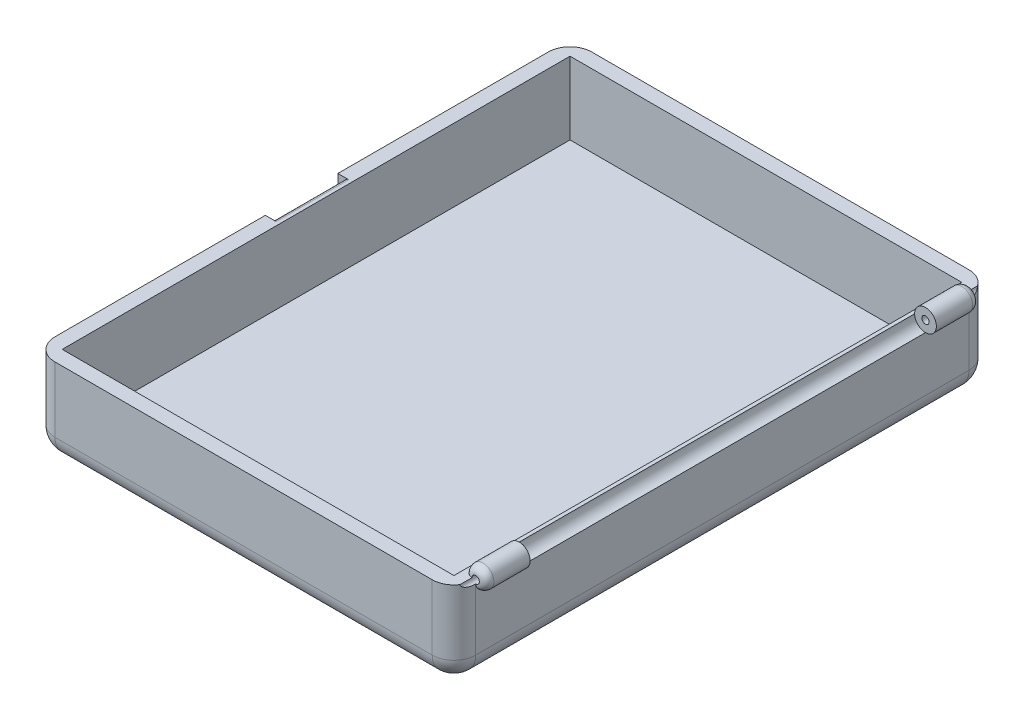
from build123d import *

# Parameters (mm, degrees)
BOTTOM_W                 = 58
BOTTOM_H                 = 74
BOTTOM_W_2               = 54
BOTTOM_H_2               = 70
DUVAR_DEPTH              = 12
BOTTOM_2_W               = 54
BOTTOM_2_H               = 70
TABAN_DEPTH              = 2
FILLET2_R                = 3
MENTESE_OUT_R            = 1.5
MENTESE_DEPTH            = 68
MENTESE_DELIK_DEPTH      = 93.355292214
MENTESE_DELIK_DEPTH_BACK = 93.355292214
MENTESE_IN_R             = 0.5
MENTESE_FILLET_R         = 1
MENTESE_OUT_CUT_R        = 1.5
MENTESE_BOSLUK_DEPTH     = 56
CENTIK_W                 = 1.5
CENTIK_H                 = 10
CENTIK_BOSLUK_DEPTH      = 7
DIL_R                    = 0.5
BOSS_EXTRUDE5_DEPTH      = 10


with BuildPart() as part:
    # bottom → duvar (new body)
    with BuildSketch(Plane(origin=(0, 0, 0), x_dir=(1, 0, 0), z_dir=(0, 1, 0))):
        with Locations((27, 35)):
            Rectangle(BOTTOM_W, BOTTOM_H)
        with Locations((27, 35)):
            Rectangle(BOTTOM_W_2, BOTTOM_H_2, mode=Mode.SUBTRACT)
    extrude(amount=DUVAR_DEPTH)

    # bottom<2> → taban (add)
    with BuildSketch(Plane(origin=(0, 0, 0), x_dir=(1, 0, 0), z_dir=(0, 1, 0))):
        with Locations((27, 35)):
            Rectangle(BOTTOM_2_W, BOTTOM_2_H)
    extrude(amount=TABAN_DEPTH)

    # Fillet2
    fillet2_edges = [part.edges().sort_by_distance(p)[0] for p in [
        (27, 0, -72),
        (56, 0, -35),
        (27, 0, 2),
        (-2, 0, -35),
        (-2, 6, -72),
        (56, 6, -72),
        (56, 6, 2),
        (-2, 6, 2),
    ]]
    fillet(fillet2_edges, radius=FILLET2_R)

    # mentese out → mentese (add)
    with BuildSketch(Plane(origin=(0, 0, -69), x_dir=(-1, 0, 0), z_dir=(0, 0, -1))):
        with Locations((-56, 12)):
            Circle(MENTESE_OUT_R)
    extrude(amount=-MENTESE_DEPTH)

    # mentese in → mentese delik (cut, two sides: drawn at the far end of the back side and taken through both)
    with BuildSketch(Plane.XY.offset(-1).offset(-MENTESE_DELIK_DEPTH_BACK)):
        with Locations(Location((56, 12, 0), (0, 0, 270))):
            Circle(MENTESE_IN_R)
    extrude(amount=MENTESE_DELIK_DEPTH + MENTESE_DELIK_DEPTH_BACK, mode=Mode.SUBTRACT)

    # mentese fillet
    mentese_fillet_edges = [part.edges().sort_by_distance(p)[0] for p in [
        (57.060660172, 13.060660172, -69),
        (57.060660172, 13.060660172, -1),
    ]]
    fillet(mentese_fillet_edges, radius=MENTESE_FILLET_R - 0.0001)  # a hair under: the kernel refuses the full size

    # mentese out cut → mentese bosluk (cut)
    with BuildSketch(Plane(origin=(0, 0, -63), x_dir=(-1, 0, 0), z_dir=(0, 0, -1))):
        with Locations((-56, 12)):
            Circle(MENTESE_OUT_CUT_R)
    extrude(amount=-MENTESE_BOSLUK_DEPTH, mode=Mode.SUBTRACT)

    # centik → centik bosluk (cut)
    with BuildSketch(Plane(origin=(0, 12, 0), x_dir=(1, 0, 0), z_dir=(0, 1, 0))):
        with Locations((-1.25, 35)):
            Rectangle(CENTIK_W, CENTIK_H)
    extrude(amount=-CENTIK_BOSLUK_DEPTH, mode=Mode.SUBTRACT)

    # dil → Boss-Extrude5 (add)
    with BuildSketch(Plane.XY.offset(-40)):
        with Locations((-0.5, 11.5)):
            Circle(DIL_R)
    extrude(amount=BOSS_EXTRUDE5_DEPTH)


solid = part.part
